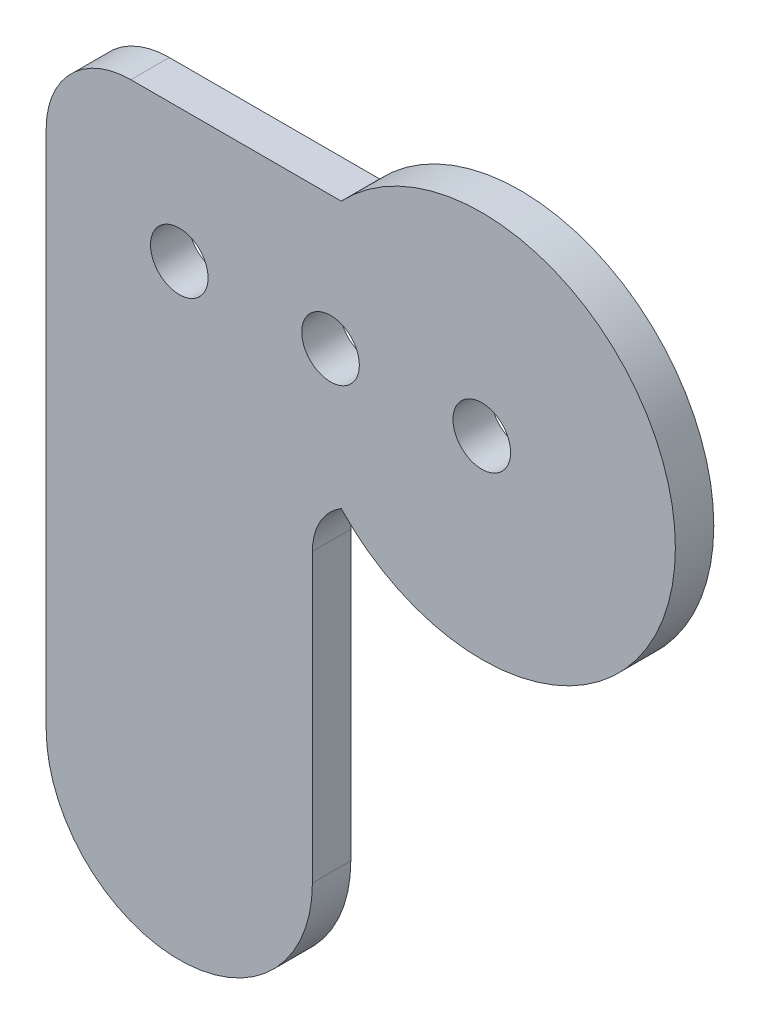
from build123d import *

# Parameters (mm, degrees)
BOSS_EXTRUDE1_DEPTH = 3.175
FILLET1_R           = 7
FILLET2_R           = 5
SKETCH2_R           = 2.38125
CUT_EXTRUDE1_DEPTH  = 62.693440697
LPATTERN1_COUNT     = 3
LPATTERN1_PITCH     = 12.5


with BuildPart() as part:
    # Sketch1 → Boss-Extrude1 (new body)
    with BuildSketch(Plane.XY):
        with BuildLine():
            Line((-11.618950039, 11), (-36, 11))
            Line((-36, 11), (-36, -39))
            ThreePointArc((-36, -39), (-25, -50), (-14, -39))
            Line((-14, -39), (-14, -11))
            Line((-14, -11), (-11.618950039, -11))
            ThreePointArc((-11.618950039, -11), (16, 0), (-11.618950039, 11))
        make_face()
    extrude(amount=BOSS_EXTRUDE1_DEPTH)

    # Fillet1
    fillet1_edges = [part.edges().sort_by_distance(p)[0] for p in [
        (-36, 11, 1.5875),
    ]]
    fillet(fillet1_edges, radius=FILLET1_R)

    # Fillet2
    # the kernel refuses this fillet: 5 mm, written as the material it adds along each edge
    with BuildSketch(Plane(origin=(-14, -11, 0), x_dir=(1, 0, 0), z_dir=(0, 0, 1))) as fillet2_piece_1:
        with BuildLine():
            CenterArc((5, -4.259237102), FILLET2_R, 121.586822832, 58.413177168)
            Line((0, -4.259237102), (-0.1, -4.259237102))
            Line((-0.1, -4.259237102), (-0.1, 0))
            Line((-0.1, 0), (0, 0.1))
            ThreePointArc((0, 0.1), (1.190524981, 0.1), (2.328670961, 0.085184742))
            Line((2.328670961, 0.085184742), (2.381049961, 0))
        make_face()
    extrude(amount=3.175)

    # Sketch2 → Cut-Extrude1 (cut, through all)
    with BuildSketch(Plane.XY.offset(3.175)):
        Circle(SKETCH2_R)
    cut_extrude1 = extrude(amount=-CUT_EXTRUDE1_DEPTH, mode=Mode.SUBTRACT)

    # LPattern1: Cut-Extrude1 ×3
    with Locations(*[(-i * LPATTERN1_PITCH, 0, 0) for i in range(1, LPATTERN1_COUNT)]):
        add(cut_extrude1, mode=Mode.SUBTRACT)


solid = part.part
